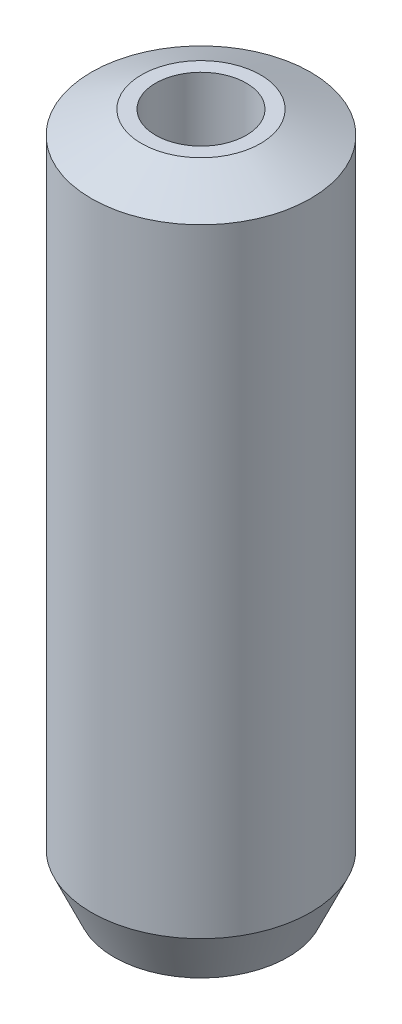
from build123d import *
from OCP.BRepFilletAPI import BRepFilletAPI_MakeChamfer

# Parameters (mm, degrees)
SKETCH1_R           = 15
BOSS_EXTRUDE1_DEPTH = 94.593658153
SKETCH2_R           = 6.198638847
CUT_EXTRUDE1_DEPTH  = 97.94307692
CHAMFER1_SIZE       = 3.1012615
CHAMFER1_SIZE2      = 6.851848547


with BuildPart() as part:
    # Sketch1 → Boss-Extrude1 (new body)
    with BuildSketch(Plane(origin=(0, 0, 0), x_dir=(1, 0, 0), z_dir=(0, 1, 0))):
        Circle(SKETCH1_R)
    extrude(amount=BOSS_EXTRUDE1_DEPTH)

    # Sketch2 → Cut-Extrude1 (cut, through all)
    with BuildSketch(Plane(origin=(0, 0, 0), x_dir=(1, 0, 0), z_dir=(0, 1, 0))):
        Circle(SKETCH2_R)
    extrude(amount=CUT_EXTRUDE1_DEPTH, mode=Mode.SUBTRACT)

    # Chamfer1: one chamfer whose edges measure the first distance from different faces: ONE call of the kernel's chamfer builder (chamfer() names one face for all edges)
    chamfer1_edges_1 = [part.edges().sort_by_distance(p)[0] for p in [
        (-15, 94.593658153, 0),
    ]]
    chamfer1_side_1 = [part.faces().sort_by_distance(p)[0] for p in [
        (-15, 47.296829076, 0),
    ]]
    chamfer1_edges_2 = [part.edges().sort_by_distance(p)[0] for p in [
        (-15, 0, 0),
    ]]
    chamfer1_side_2 = [part.faces().sort_by_distance(p)[0] for p in [
        (-14.575735931, 0, 0),
    ]]
    chamfer1 = BRepFilletAPI_MakeChamfer(part.part.solid().wrapped)
    for e in chamfer1_edges_1:
        chamfer1.Add(CHAMFER1_SIZE, CHAMFER1_SIZE2, e.wrapped, chamfer1_side_1[0].wrapped)  # the first distance lies on this face
    for e in chamfer1_edges_2:
        chamfer1.Add(CHAMFER1_SIZE, CHAMFER1_SIZE2, e.wrapped, chamfer1_side_2[0].wrapped)  # the first distance lies on this face
    add(Compound.cast(chamfer1.Shape()), mode=Mode.REPLACE)


solid = part.part
